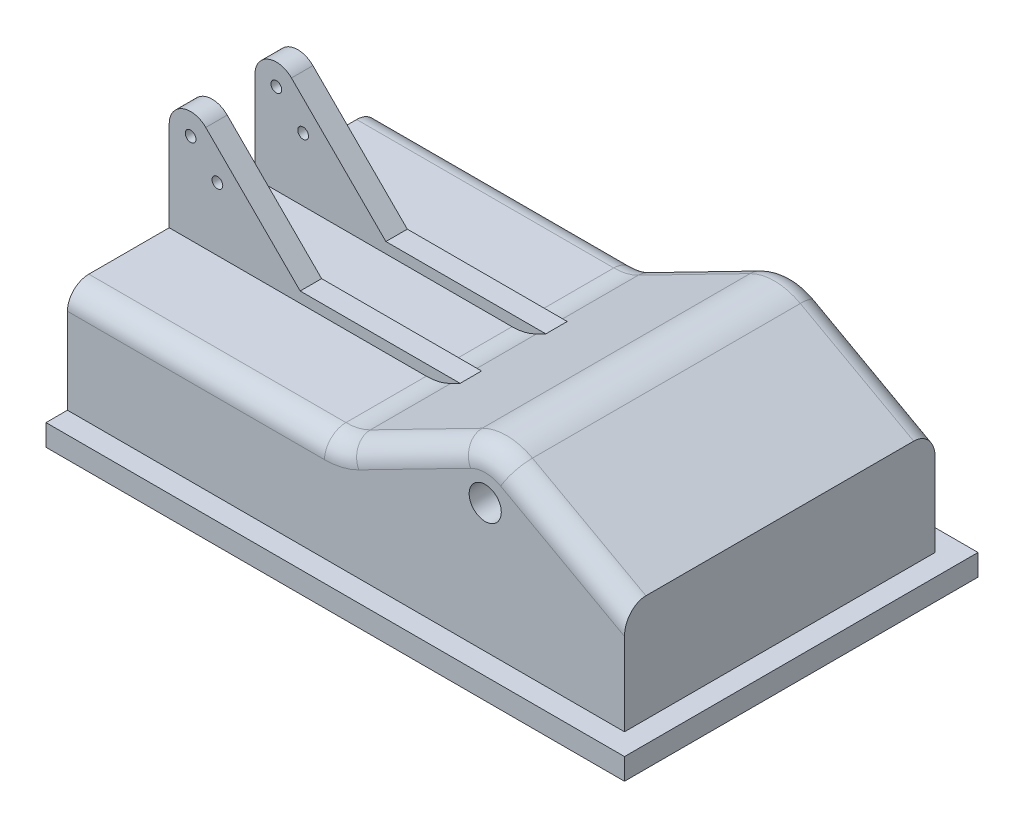
from build123d import *

# Parameters (mm, degrees)
SKETCH1_R           = 15
BOSS_EXTRUDE2_DEPTH = 145
BOSS_EXTRUDE3_START = 50
SKETCH5_R           = 5
BOSS_EXTRUDE3_DEPTH = 20
SHELL1_START        = -125
SHELL1_DEPTH        = 250
SKETCH6_W           = 520
SKETCH6_H           = 290
BOSS_EXTRUDE4_DEPTH = 20
FILLET1_R           = 20


# Read off the part's stored shape, not the designer's step: Shell1
with BuildPart() as part:
    # Sketch1 → Boss-Extrude2 (new, symmetric)
    with BuildSketch(Plane.XY):
        with BuildLine():
            Line((0, 120), (0, 0))
            Line((0, 0), (520, 0))
            Line((520, 0), (520, 120))
            Line((520, 120), (414.127591904, 178.329519311))
            ThreePointArc((414.127591904, 178.329519311), (390.743657055, 184.530618142), (367.18562851, 179.027770991))
            Line((367.18562851, 179.027770991), (262.81437149, 125.508377715))
            ThreePointArc((262.81437149, 125.508377715), (251.734966676, 121.396599326), (240, 120))
            Line((240, 120), (0, 120))
        make_face()
        with Locations((390, 140)):
            Circle(SKETCH1_R, mode=Mode.SUBTRACT)
    extrude(amount=BOSS_EXTRUDE2_DEPTH, both=True)

    # Sketch5 → Boss-Extrude3 (add)
    with BuildSketch(Plane.XY.offset(BOSS_EXTRUDE3_START)):
        with BuildLine():
            Line((240, 120), (0, 120))
            Line((0, 120), (0, 204))
            ThreePointArc((0, 204), (12.346331353, 222.47759065), (34.142135624, 218.142135624))
            Line((34.142135624, 218.142135624), (122.284271247, 130))
            Line((122.284271247, 130), (271.573743284, 130))
            Line((271.573743284, 130), (262.81437149, 125.508377715))
            ThreePointArc((262.81437149, 125.508377715), (251.734966676, 121.396599326), (240, 120))
        make_face()
        with Locations((20, 204)):
            Circle(SKETCH5_R, mode=Mode.SUBTRACT)
        with Locations((45, 179)):
            Circle(SKETCH5_R, mode=Mode.SUBTRACT)
    extrude(amount=-BOSS_EXTRUDE3_DEPTH)

    # Mirror1: part across plane


with BuildPart() as part_1:
    add(part.part)
    add(part.part.mirror(Plane.XY))

    # Shell1 outline → Shell1 (cut)
    with BuildSketch(Plane.XY.offset(SHELL1_START)):
        with BuildLine():
            Line((356.85957207, 151.256644109), (271.940120086, 107.711728801))
            ThreePointArc((271.940120086, 107.711728801), (256.428953346, 101.955239056), (240, 100))
            Line((240, 100), (20, 100))
            Line((20, 100), (20, 0))
            Line((20, 0), (500, 0))
            Line((500, 0), (500, 108.184326651))
            Line((500, 108.184326651), (423.428190104, 150.370926015))
            ThreePointArc((423.428190104, 150.370926015), (389.534354317, 105.00309765), (356.85957207, 151.256644109))
        make_face()
    extrude(amount=SHELL1_DEPTH, mode=Mode.SUBTRACT)

    # Sketch6 → Boss-Extrude4 (add)
    # profile 1 of 2: a face of its own
    with BuildSketch(Plane.XZ):
        with Locations((260, 0)):
            Rectangle(SKETCH6_W, SKETCH6_H)
        Polygon((20, 125), (500, 125), (500, -125), (240, -125), (20, -125), align=None, mode=Mode.SUBTRACT)
    # profile 2 of 2: a face of its own
    with BuildSketch(Plane.XZ):
        Polygon((540, 165), (0, 165), (0, 145), (520, 145), (520, -145), (0, -145), (0, -165), (540, -165), align=None)
    extrude(amount=-BOSS_EXTRUDE4_DEPTH)

    # Fillet1
    fillet1_edges = [part_1.edges().sort_by_distance(p)[0] for p in [
        (120, 120, -145),
        (467.063795952, 149.164759656, 145),
        (390.743657055, 184.530618142, 145),
        (315, 152.268074353, 145),
        (251.734966676, 121.396599326, 145),
        (120, 120, 145),
        (251.734966676, 121.396599326, -145),
        (315, 152.268074353, -145),
        (390.743657055, 184.530618142, -145),
        (467.063795952, 149.164759656, -145),
    ]]
    fillet(fillet1_edges, radius=FILLET1_R)


solid = part_1.part
